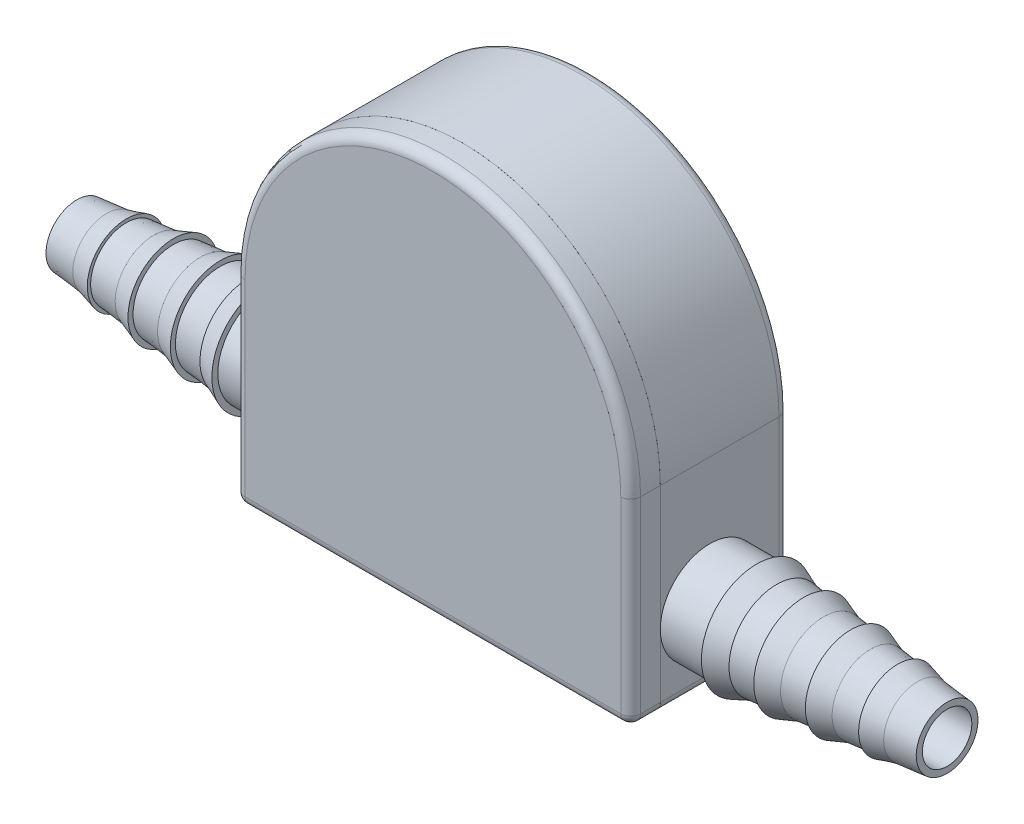
from build123d import *

# Parameters (mm, degrees)
BOSS_EXTRUDE1_START          = 8
BOSS_EXTRUDE1_DEPTH          = 16
FILLET1_R                    = 1
CUT_EXTRUDE_THIN1_START      = -40
SKETCH5_W                    = 0.00254
SKETCH5_H                    = 50.8
CUT_EXTRUDE_THIN1_DEPTH      = 40
SHELL1_T                     = -2
DELETEFACE1_START            = 5.00254
DELETEFACE1_DEPTH            = 0.99746
SKETCH6_R                    = 18
SKETCH6_W                    = 36
SKETCH6_H                    = 5
CUT_EXTRUDE2_DEPTH           = 11
SKETCH7_W                    = 5
SKETCH7_H                    = 2.4
CUT_EXTRUDE3_DEPTH           = 6.6
CUT_EXTRUDE3_DRAFT           = -1
CUT_EXTRUDE3_PROFILE_2_DEPTH = 6.6
CUT_EXTRUDE3_PROFILE_2_DRAFT = -1
SKETCH8_R                    = 2.5
CUT_EXTRUDE4_DEPTH           = 91.598013223
SKETCH9_R                    = 1.25
BOSS_EXTRUDE2_DEPTH          = 3
BOSS_EXTRUDE2_TAPER          = 1
FILLET2_R                    = 1
SKETCH10_R                   = 1.25
BOSS_EXTRUDE3_DEPTH          = 3
BOSS_EXTRUDE3_TAPER          = 1
FILLET3_R                    = 1
BOSS_EXTRUDE4_START          = 1
SKETCH11_R                   = 1.25
BOSS_EXTRUDE4_DEPTH          = 4
CHAMFER1_SIZE                = 2.5
CUT_EXTRUDE5_DEPTH           = 3.75
FILLET4_R                    = 0.25
FILLET5_R                    = 0.1


# Read off the part's stored shape, not the designer's step: DeleteFace1
with BuildPart() as part:
    # Sketch3 → Boss-Extrude1 (new body)
    with BuildSketch(Plane.XY.offset(BOSS_EXTRUDE1_START)):
        with BuildLine():
            Line((20, -20), (-20, -20))
            Line((-20, -20), (-20, 0))
            ThreePointArc((-20, 0), (0, 20), (20, 0))
            Line((20, 0), (20, -20))
        make_face()
    extrude(amount=-BOSS_EXTRUDE1_DEPTH)

    # Sketch4 → Revolve1 (revolve)
    with BuildSketch(Plane.XY, mode=Mode.PRIVATE) as revolve1_sk:
        Polygon((44, -9.475), (44, -10.1), (-44, -10.1), (-44, -9.475), (-41, -9.182792208), (-39, -8.65), (-39, -8.987987013), (-36.25, -8.72012987), (-34.25, -8.011892725), (-34.25, -8.525324675), (-31.5, -8.257467532), (-29.5, -7.549230387), (-29.5, -8.062662338), (-26.75, -7.794805195), (-24.75, -7), (-24.75, -7.6), (24.75, -7.6), (24.75, -7), (26.75, -7.794805195), (29.5, -8.062662338), (29.5, -7.549230387), (31.5, -8.257467532), (34.25, -8.525324675), (34.25, -8.011892725), (36.25, -8.72012987), (39, -8.987987013), (39, -8.65), (41, -9.182792208), align=None)
    revolve(revolve1_sk.sketch.rotate(Axis((-44, -12.6, 0), (1, 0, 0)), 180), axis=Axis((-44, -12.6, 0), (1, 0, 0)))

    # Fillet1
    fillet1_edges = [part.edges().sort_by_distance(p)[0] for p in [
        (-20, -10, -8),
        (0, -20, -8),
        (20, -10, -8),
        (0, -20, 8),
        (-20, -10, 8),
        (0, 20, 8),
        (20, -10, 8),
        (0, 20, -8),
        (20, -20, 0),
        (-20, -20, 0),
    ]]
    fillet(fillet1_edges, radius=FILLET1_R)

    # Sketch5 → Cut-Extrude-Thin1 (cut)
    with BuildSketch(Plane(origin=(20, 0, 0), x_dir=(0, 0, -1), z_dir=(1, 0, 0)).offset(CUT_EXTRUDE_THIN1_START)):
        with Locations((-5.00127, 0)):
            Rectangle(SKETCH5_W, SKETCH5_H)
    extrude(amount=CUT_EXTRUDE_THIN1_DEPTH, mode=Mode.SUBTRACT)


with BuildPart() as cut_extrude_thin1_piece_1:
    # of the separate pieces the step leaves, piece 1, a body of its own (cut_extrude_thin1_pieces)
    add(part.part.solids().sort_by_distance((20, -12.6, 5))[0])

    # Sketch6 → Cut-Extrude2 (cut)
    with BuildSketch(Plane.XY.offset(5)):
        Circle(SKETCH6_R)
        with Locations((0, -12.6)):
            Rectangle(SKETCH6_W, SKETCH6_H)
    extrude(amount=-CUT_EXTRUDE2_DEPTH, mode=Mode.SUBTRACT)


with BuildPart() as cut_extrude_thin1_piece_2:
    # of the separate pieces the step leaves, piece 2, a body of its own (cut_extrude_thin1_pieces)
    add(part.part.solids().sort_by_distance((20, 0, 7))[0])

    # Shell1
    shell1_openings = [cut_extrude_thin1_piece_2.faces().sort_by_distance(p)[0] for p in [
        (0, -1.861613791, 5.00254),
    ]]
    offset(amount=SHELL1_T, openings=shell1_openings, kind=Kind.INTERSECTION)

    # DeleteFace1 outline → DeleteFace1 (add)
    with BuildSketch(Plane.XY.offset(DELETEFACE1_START)):
        with BuildLine():
            Line((18, -18), (18, 0))
            ThreePointArc((18, 0), (12.727922061, -12.727922061), (0, -18))
            Line((0, -18), (18, -18))
        make_face()
        with BuildLine():
            ThreePointArc((0, -18), (-12.727922061, -12.727922061), (-18, 0))
            Line((-18, 0), (-18, -18))
            Line((-18, -18), (0, -18))
        make_face()
    extrude(amount=DELETEFACE1_DEPTH)

    # Sketch10 → Boss-Extrude3 (add)
    with BuildSketch(Plane(origin=(0, 0, 6), x_dir=(-1, 0, 0), z_dir=(0, 0, -1))):
        Circle(SKETCH10_R)
    extrude(amount=BOSS_EXTRUDE3_DEPTH, taper=BOSS_EXTRUDE3_TAPER)

    # Fillet3
    fillet3_edges = [cut_extrude_thin1_piece_2.edges().sort_by_distance(p)[0] for p in [
        (1.25, 0, 6),
    ]]
    fillet(fillet3_edges, radius=FILLET3_R)


with BuildPart() as cut_extrude3_tool:
    # Sketch7 → Cut-Extrude3 (with draft: the straight prism first)
    with BuildSketch(Plane(origin=(0, 0, -8), x_dir=(-1, 0, 0), z_dir=(0, 0, -1))):
        with Locations((-14.5, -17.4)):
            Rectangle(SKETCH7_W, SKETCH7_H)
    extrude(amount=-CUT_EXTRUDE3_DEPTH)
    # Cut-Extrude3: the draft: its side faces are tilted about the plane it starts from
    cut_extrude3_sides = [cut_extrude3_tool.faces().sort_by_distance(p)[0] for p in [
        (14.5, -16.2, -4.7),
        (17, -17.4, -4.7),
        (14.5, -18.6, -4.7),
        (12, -17.4, -4.7),
    ]]
    draft(cut_extrude3_sides, Plane(origin=(0, 0, -8), x_dir=(-1, 0, 0), z_dir=(0, 0, -1)), CUT_EXTRUDE3_DRAFT)


with BuildPart() as cut_extrude_thin1_piece_1_1:
    add(cut_extrude_thin1_piece_1.part)

    # Cut-Extrude3: cut by cut_extrude3_tool
    add(cut_extrude3_tool.part, mode=Mode.SUBTRACT)


with BuildPart() as cut_extrude3_profile_2_tool:
    # Sketch7 → Cut-Extrude3 profile 2 (with draft: the straight prism first)
    with BuildSketch(Plane(origin=(0, 0, -8), x_dir=(-1, 0, 0), z_dir=(0, 0, -1))):
        with Locations((14.5, -17.4)):
            Rectangle(SKETCH7_W, SKETCH7_H)
    extrude(amount=-CUT_EXTRUDE3_PROFILE_2_DEPTH)
    # Cut-Extrude3 profile 2: the draft: its side faces are tilted about the plane it starts from
    cut_extrude3_profile_2_sides = [cut_extrude3_profile_2_tool.faces().sort_by_distance(p)[0] for p in [
        (-12, -17.4, -4.7),
        (-14.5, -18.6, -4.7),
        (-17, -17.4, -4.7),
        (-14.5, -16.2, -4.7),
    ]]
    draft(cut_extrude3_profile_2_sides, Plane(origin=(0, 0, -8), x_dir=(-1, 0, 0), z_dir=(0, 0, -1)), CUT_EXTRUDE3_PROFILE_2_DRAFT)


with BuildPart() as cut_extrude_thin1_piece_1_2:
    add(cut_extrude_thin1_piece_1_1.part)

    # Cut-Extrude3 profile 2: cut by cut_extrude3_profile_2_tool
    add(cut_extrude3_profile_2_tool.part, mode=Mode.SUBTRACT)

    # Sketch8 → Cut-Extrude4 (cut, through all)
    with BuildSketch(Plane(origin=(44, 0, 0), x_dir=(0, 0, -1), z_dir=(1, 0, 0))):
        with Locations(Location((0, -12.6, 0), (0, 0, 270))):
            Circle(SKETCH8_R)
    extrude(amount=-CUT_EXTRUDE4_DEPTH, mode=Mode.SUBTRACT)

    # Sketch9 → Boss-Extrude2 (add)
    with BuildSketch(Plane.XY.offset(-6)):
        Circle(SKETCH9_R)
    extrude(amount=BOSS_EXTRUDE2_DEPTH, taper=BOSS_EXTRUDE2_TAPER)

    # Fillet2
    fillet2_edges = [cut_extrude_thin1_piece_1_2.edges().sort_by_distance(p)[0] for p in [
        (-1.25, 0, -6),
    ]]
    fillet(fillet2_edges, radius=FILLET2_R)


with BuildPart() as body_3:
    # Sketch11 → Boss-Extrude4 (new body)
    with BuildSketch(Plane.XY.offset(BOSS_EXTRUDE4_START)):
        with BuildLine():
            Line((-17.483921185, 0.75), (-3.100370946, 0.75))
            ThreePointArc((-3.100370946, 0.75), (-2.199704526, 1.27), (-2.199704526, 2.31))
            Line((-2.199704526, 2.31), (-9.391479645, 14.766519904))
            ThreePointArc((-9.391479645, 14.766519904), (0, 17.5), (9.391479645, 14.766519904))
            Line((9.391479645, 14.766519904), (2.199704526, 2.31))
            ThreePointArc((2.199704526, 2.31), (2.199704526, 1.27), (3.100370946, 0.75))
            Line((3.100370946, 0.75), (17.483921185, 0.75))
            ThreePointArc((17.483921185, 0.75), (15.155444566, -8.75), (8.09244154, -15.516519904))
            Line((8.09244154, -15.516519904), (0.90066642, -3.06))
            ThreePointArc((0.90066642, -3.06), (0, -2.54), (-0.90066642, -3.06))
            Line((-0.90066642, -3.06), (-8.09244154, -15.516519904))
            ThreePointArc((-8.09244154, -15.516519904), (-15.155444566, -8.75), (-17.483921185, 0.75))
        make_face()
        Circle(SKETCH11_R, mode=Mode.SUBTRACT)
    extrude(amount=BOSS_EXTRUDE4_DEPTH)

    # Chamfer1
    chamfer1_edges = [body_3.edges().sort_by_distance(p)[0] for p in [
        (-15.155444566, -8.75, 5),
        (15.155444566, -8.75, 5),
        (0, 17.5, 5),
    ]]
    chamfer(chamfer1_edges, length=CHAMFER1_SIZE)

    # Sketch12 → Cut-Extrude5 (cut)
    with BuildSketch(Plane.XY.offset(5)):
        with BuildLine():
            Line((0.90066642, 3.06), (8.342665053, 15.949919743))
            ThreePointArc((8.342665053, 15.949919743), (0, 18), (-8.342665053, 15.949919743))
            Line((-8.342665053, 15.949919743), (-0.90066642, 3.06))
            ThreePointArc((-0.90066642, 3.06), (0, 2.54), (0.90066642, 3.06))
        make_face()
        with BuildLine():
            Line((3.100370946, -0.75), (17.984368212, -0.75))
            ThreePointArc((17.984368212, -0.75), (15.588457268, -9), (9.641703159, -15.199919743))
            Line((9.641703159, -15.199919743), (2.199704526, -2.31))
            ThreePointArc((2.199704526, -2.31), (2.199704526, -1.27), (3.100370946, -0.75))
        make_face()
        with BuildLine():
            Line((-2.199704526, -2.31), (-9.641703159, -15.199919743))
            ThreePointArc((-9.641703159, -15.199919743), (-15.588457268, -9), (-17.984368212, -0.75))
            Line((-17.984368212, -0.75), (-3.100370946, -0.75))
            ThreePointArc((-3.100370946, -0.75), (-2.199704526, -1.27), (-2.199704526, -2.31))
        make_face()
    extrude(amount=-CUT_EXTRUDE5_DEPTH, mode=Mode.SUBTRACT)

    # Fillet4
    fillet4_edges = [body_3.edges().sort_by_distance(p)[0] for p in [
        (-5.795592085, -8.538259952, 1.25),
        (-2.199704526, -1.27, 1.25),
        (5.795592085, -8.538259952, 1.25),
        (2.199704526, -1.27, 1.25),
        (-4.49655398, 9.288259952, 1.25),
        (0, 2.54, 1.25),
        (-1.25, 0, 5),
        (-8.75, -15.155444566, 2.5),
        (-7.5, -12.990381057, 5),
        (-17.5, 0, 2.5),
        (-15, 0, 5),
        (-10.292146065, -0.75, 1.25),
        (10.292146065, -0.75, 1.25),
        (8.75, -15.155444566, 2.5),
        (7.5, -12.990381057, 5),
        (17.5, 0, 2.5),
        (15, 0, 5),
        (8.75, 15.155444566, 2.5),
        (7.5, 12.990381057, 5),
        (-7.5, 12.990381057, 5),
        (4.49655398, 9.288259952, 1.25),
        (-8.75, 15.155444566, 2.5),
    ]]
    fillet(fillet4_edges, radius=FILLET4_R)

    # Fillet5
    fillet5_edges = [body_3.edges().sort_by_distance(p)[0] for p in [
        (0, 2.54, 5),
        (3.844962256, 8.15966998, 5),
        (2.199704526, -1.27, 5),
        (5.144000361, -7.40966998, 5),
        (-2.199704526, -1.27, 5),
        (-8.988962617, -0.75, 5),
        (-8.765837684, -13.68287624, 3.750045769),
        (-5.144000361, -7.40966998, 5),
        (-9.391479645, -14.766519904, 1.948223305),
        (-8.13618421, -12.592284431, 4.980976313),
        (-9.381953532, -14.750020192, 2.492128538),
        (-15.155444566, -8.75, 1.25),
        (8.765837684, -13.68287624, 3.750045769),
        (9.391479645, -14.766519904, 1.948223305),
        (8.13618421, -12.592284431, 4.980976313),
        (9.381953532, -14.750020192, 2.492128538),
        (15.155444566, -8.75, 1.25),
        (-7.466799578, 14.43287624, 3.750045769),
        (-3.844962256, 8.15966998, 5),
        (-8.09244154, 15.516519904, 1.948223305),
        (-8.082915426, 15.500020192, 2.492128538),
        (-6.837146104, 13.342284431, 4.980976313),
        (0, 17.5, 1.25),
        (-5.144000361, 7.40966998, 5),
        (-3.844962256, -8.15966998, 5),
        (8.988962617, -0.75, 5),
        (8.988962617, 0.75, 5),
        (-17.483921185, -0.75, 1.948223305),
        (-17.483921185, 0.75, 1.698223305),
        (-8.09244154, -15.516519904, 1.698223305),
        (-7.466799578, -14.43287624, 3.750045769),
        (-6.837146104, -13.342284431, 4.980976313),
        (-8.082915426, -15.500020192, 2.492128538),
        (-16.232637262, 0.75, 3.750045769),
        (-14.973330314, 0.75, 4.980976313),
        (-17.464868959, 0.75, 2.492128538),
        (-16.232637262, -0.75, 3.750045769),
        (-14.973330314, -0.75, 4.980976313),
        (-17.464868959, -0.75, 2.492128538),
        (16.232637262, -0.75, 3.750045769),
        (17.483921185, -0.75, 1.948223305),
        (14.973330314, -0.75, 4.980976313),
        (17.464868959, -0.75, 2.492128538),
        (8.09244154, -15.516519904, 1.698223305),
        (17.483921185, 0.75, 1.698223305),
        (7.466799578, -14.43287624, 3.750045769),
        (6.837146104, -13.342284431, 4.980976313),
        (8.082915426, -15.500020192, 2.492128538),
        (16.232637262, 0.75, 3.750045769),
        (14.973330314, 0.75, 4.980976313),
        (17.464868959, 0.75, 2.492128538),
        (8.09244154, 15.516519904, 1.948223305),
        (9.391479645, 14.766519904, 1.698223305),
        (-9.391479645, 14.766519904, 1.698223305),
        (8.765837684, 13.68287624, 3.750045769),
        (8.13618421, 12.592284431, 4.980976313),
        (9.381953532, 14.750020192, 2.492128538),
        (7.466799578, 14.43287624, 3.750045769),
        (6.837146104, 13.342284431, 4.980976313),
        (8.082915426, 15.500020192, 2.492128538),
        (-8.765837684, 13.68287624, 3.750045769),
        (-9.381953532, 14.750020192, 2.492128538),
        (-8.13618421, 12.592284431, 4.980976313),
        (-9.453300508, -14.727019709, 1.323158098),
        (9.453300508, -14.727019709, 1.323158098),
        (-8.027322936, 15.550308244, 1.323158098),
        (-17.480623444, -0.823288535, 1.323158098),
        (17.480623444, -0.823288535, 1.323158098),
        (8.027322936, 15.550308244, 1.323158098),
        (-2.199704526, 1.27, 5),
        (-8.988962617, 0.75, 5),
        (0, -2.54, 5),
        (3.844962256, -8.15966998, 5),
        (2.199704526, 1.27, 5),
        (5.144000361, 7.40966998, 5),
    ]]
    fillet(fillet5_edges, radius=FILLET5_R)

    # Mirror1: body 3 across plane


with BuildPart() as body_3_1:
    add(body_3.part)
    add(body_3.part.mirror(Plane(origin=(-3.100370946, 1.79, 1), x_dir=(1, 0, 0), z_dir=(0, 0, 1))))


solid = Compound([cut_extrude_thin1_piece_2.part, cut_extrude_thin1_piece_1_2.part, body_3_1.part])
